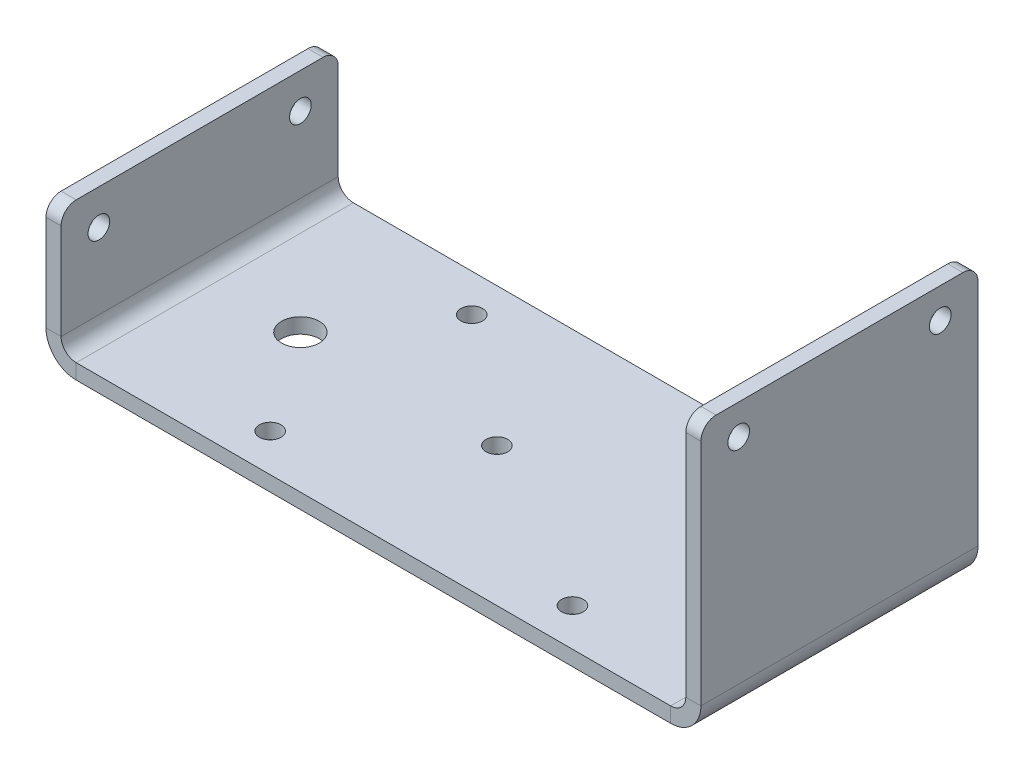
from build123d import *

# Parameters (mm, degrees)
SKETCH1_W                    = 124
SKETCH1_H                    = 55
SKETCH1_R                    = 1
SKETCH1_R_2                  = 3.75
BASE_FLANGE1_DEPTH           = 3
EDGE_FLANGE1_STRIP_W         = 18
EDGE_FLANGE1_STRIP_H         = 3
EDGE_FLANGE1_STRIP_CUT_DEPTH = 55
EDGE_FLANGE1_DEPTH           = 55
EDGE_FLANGE1_START           = 3
EDGE_FLANGE1_PROFILE_W       = 55
EDGE_FLANGE1_PROFILE_H       = 22
EDGE_FLANGE1_PROFILE_R       = 1
EDGE_FLANGE1_FLAT_DEPTH      = 3
EDGE_FLANGE2_STRIP_W         = 18
EDGE_FLANGE2_STRIP_H         = 3
EDGE_FLANGE2_STRIP_CUT_DEPTH = 55
EDGE_FLANGE2_DEPTH           = 55
EDGE_FLANGE2_START           = 3
EDGE_FLANGE2_PROFILE_W       = 55
EDGE_FLANGE2_PROFILE_H       = 48.5
EDGE_FLANGE2_PROFILE_R       = 1
EDGE_FLANGE2_FLAT_DEPTH      = 3
M4_CLEARANCE_HOLE1_D         = 4.3
M4_CLEARANCE_HOLE1_DEPTH     = 130
M4_CLEARANCE_HOLE2_D         = 4.3
M4_CLEARANCE_HOLE2_DEPTH     = 3
M4_CLEARANCE_HOLE2_TIP       = 1.291850331
M4_CLEARANCE_HOLE3_D         = 4.3
M4_CLEARANCE_HOLE3_DEPTH     = 3
M4_CLEARANCE_HOLE3_TIP       = 1.291850331
FILLET1_R                    = 3


# Sheet-metal steps are written as plain solids
with BuildPart() as part:
    # Sketch1 → Base-Flange1 (new body)
    with BuildSketch(Plane(origin=(0, 0, 0), x_dir=(1, 0, 0), z_dir=(0, 1, 0))):
        with Locations((3, 0)):
            Rectangle(SKETCH1_W, SKETCH1_H)
        with Locations(Location((-25, 20, 0), (0, 0, 270))):
            Circle(SKETCH1_R, mode=Mode.SUBTRACT)
        with Locations(Location((35, 20, 0), (0, 0, 270))):
            Circle(SKETCH1_R, mode=Mode.SUBTRACT)
        with Locations(Location((-25, -20, 0), (0, 0, 270))):
            Circle(SKETCH1_R, mode=Mode.SUBTRACT)
        with Locations(Location((35, -20, 0), (0, 0, 270))):
            Circle(SKETCH1_R, mode=Mode.SUBTRACT)
        with Locations(Location((45, 0, 0), (0, 0, 270))):
            Circle(SKETCH1_R_2, mode=Mode.SUBTRACT)
        with Locations(Location((-39, 0, 0), (0, 0, 270))):
            Circle(SKETCH1_R_2, mode=Mode.SUBTRACT)
        with Locations(Location((0, 0, 0), (0, 0, 270))):
            Circle(SKETCH1_R, mode=Mode.SUBTRACT)
    extrude(amount=-BASE_FLANGE1_DEPTH)

    # Edge-Flange1 strip (across the edge) → Edge-Flange1 strip cut (cut)
    with BuildSketch(Plane(origin=(-59, 0, -27.5), x_dir=(1, 0, 0), z_dir=(0, 0, 1))):
        with Locations((-6, -1.5)):
            Rectangle(EDGE_FLANGE1_STRIP_W, EDGE_FLANGE1_STRIP_H)
    extrude(amount=EDGE_FLANGE1_STRIP_CUT_DEPTH, mode=Mode.SUBTRACT)

    # Edge-Flange1 bend section (across the edge) → Edge-Flange1 (add)
    with BuildSketch(Plane(origin=(-59, 0, -27.5), x_dir=(1, 0, 0), z_dir=(0, 0, 1))):
        with BuildLine():
            Line((-3, 3), (0, 3))
            ThreePointArc((0, 3), (0.878679656, 0.878679656), (3, 0))
            Line((3, 0), (3, -3))
            ThreePointArc((3, -3), (-1.242640687, -1.242640687), (-3, 3))
        make_face()
    extrude(amount=EDGE_FLANGE1_DEPTH)

    # Edge-Flange1 profile (on flange) → Edge-Flange1 flat (add)
    with BuildSketch(Plane.ZY.offset(59).offset(EDGE_FLANGE1_START)):
        with Locations((0, 14)):
            Rectangle(EDGE_FLANGE1_PROFILE_W, EDGE_FLANGE1_PROFILE_H)
        with Locations((-20, 18)):
            Circle(EDGE_FLANGE1_PROFILE_R, mode=Mode.SUBTRACT)
        with Locations((20, 18)):
            Circle(EDGE_FLANGE1_PROFILE_R, mode=Mode.SUBTRACT)
    extrude(amount=-EDGE_FLANGE1_FLAT_DEPTH)

    # Edge-Flange2 strip (across the edge) → Edge-Flange2 strip cut (cut)
    with BuildSketch(Plane(origin=(65, 0, 27.5), x_dir=(-1, 0, 0), z_dir=(0, 0, -1))):
        with Locations((-6, -1.5)):
            Rectangle(EDGE_FLANGE2_STRIP_W, EDGE_FLANGE2_STRIP_H)
    extrude(amount=EDGE_FLANGE2_STRIP_CUT_DEPTH, mode=Mode.SUBTRACT)

    # Edge-Flange2 bend section (across the edge) → Edge-Flange2 (add)
    with BuildSketch(Plane(origin=(65, 0, 27.5), x_dir=(-1, 0, 0), z_dir=(0, 0, -1))):
        with BuildLine():
            Line((-3, 3), (0, 3))
            ThreePointArc((0, 3), (0.878679656, 0.878679656), (3, 0))
            Line((3, 0), (3, -3))
            ThreePointArc((3, -3), (-1.242640687, -1.242640687), (-3, 3))
        make_face()
    extrude(amount=EDGE_FLANGE2_DEPTH)

    # Edge-Flange2 profile (on flange) → Edge-Flange2 flat (add)
    with BuildSketch(Plane(origin=(65, 0, 0), x_dir=(0, 0, -1), z_dir=(1, 0, 0)).offset(EDGE_FLANGE2_START)):
        with Locations((0, 27.25)):
            Rectangle(EDGE_FLANGE2_PROFILE_W, EDGE_FLANGE2_PROFILE_H)
        with Locations((-20, 45.5)):
            Circle(EDGE_FLANGE2_PROFILE_R, mode=Mode.SUBTRACT)
        with Locations((20, 45.5)):
            Circle(EDGE_FLANGE2_PROFILE_R, mode=Mode.SUBTRACT)
    extrude(amount=-EDGE_FLANGE2_FLAT_DEPTH)

    # M4 Clearance Hole1
    with Locations(Plane(origin=(68, 0, 0), x_dir=(0, 0, -1), z_dir=(1, 0, 0))):
        with Locations((-20, 45.5), (20, 45.5)):
            Hole(M4_CLEARANCE_HOLE1_D / 2, depth=M4_CLEARANCE_HOLE1_DEPTH)

    # M4 Clearance Hole2
    with Locations(Plane.ZY.offset(62)):
        with Locations((-20, 18), (20, 18)):
            Hole(M4_CLEARANCE_HOLE2_D / 2, depth=M4_CLEARANCE_HOLE2_DEPTH)
            with Locations((0, 0, -(M4_CLEARANCE_HOLE2_DEPTH + M4_CLEARANCE_HOLE2_TIP / 2))):  # 118° drill point
                Cone(0, M4_CLEARANCE_HOLE2_D / 2, M4_CLEARANCE_HOLE2_TIP, mode=Mode.SUBTRACT)

    # M4 Clearance Hole3
    with Locations(Plane(origin=(0, -3, 0), x_dir=(-1, 0, 0), z_dir=(0, -1, 0))):
        with Locations((-35, 20), (25, 20), (25, -20), (-35, -20), (0, 0)):
            Hole(M4_CLEARANCE_HOLE3_D / 2, depth=M4_CLEARANCE_HOLE3_DEPTH)
            with Locations((0, 0, -(M4_CLEARANCE_HOLE3_DEPTH + M4_CLEARANCE_HOLE3_TIP / 2))):  # 118° drill point
                Cone(0, M4_CLEARANCE_HOLE3_D / 2, M4_CLEARANCE_HOLE3_TIP, mode=Mode.SUBTRACT)

    # Fillet1
    fillet1_edges = [part.edges().sort_by_distance(p)[0] for p in [
        (66.5, 51.5, 27.5),
        (66.5, 51.5, -27.5),
        (-60.5, 25, -27.5),
        (-60.5, 25, 27.5),
    ]]
    fillet(fillet1_edges, radius=FILLET1_R)


solid = part.part
